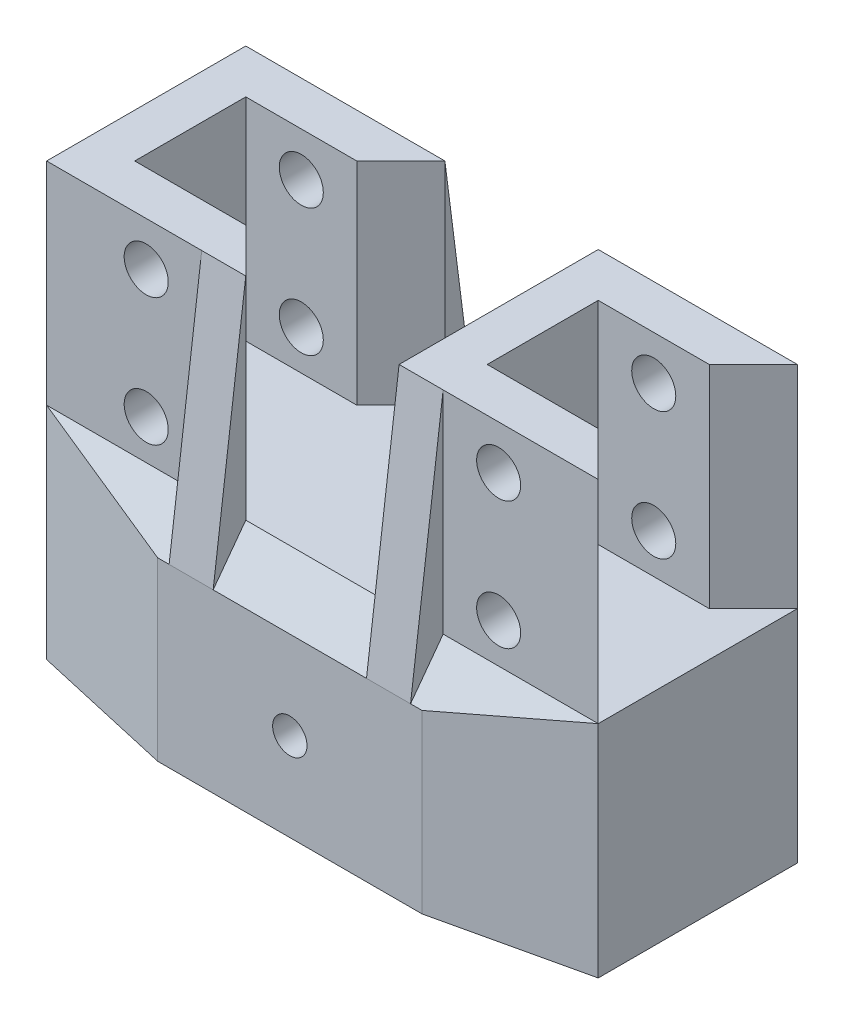
from build123d import *
from OCP.BRepFilletAPI import BRepFilletAPI_MakeChamfer

# Parameters (mm, degrees)
BOSS_EXTRUDE1_DEPTH     = 24
SKETCH2_R               = 2.5
CUT_EXTRUDE1_DEPTH      = 46.458222579
SKETCH3_W               = 62.6
SKETCH3_H               = 22.6
BOSS_EXTRUDE2_DEPTH     = 5
SKETCH4_W               = 30
SKETCH4_H               = 30
SKETCH4_W_2             = 20
SKETCH4_H_2             = 20
BOSS_EXTRUDE3_DEPTH     = 20
SKETCH6_W               = 20
SKETCH6_H               = 20
BOSS_EXTRUDE4_DEPTH     = 20
SKETCH8_W               = 2
SKETCH8_H               = 4.711017494
SKETCH8_W_2             = 4.711017494
SKETCH8_H_2             = 2
BOSS_EXTRUDE5_DEPTH     = 20
SKETCH9_W               = 5
SKETCH9_H               = 3.7
BOSS_EXTRUDE6_DEPTH     = 29
CHAMFER1_SIZE           = 29
CHAMFER1_SIZE2          = 3.7
CHAMFER3_SIZE           = 3.7
CHAMFER3_SIZE_2         = 5
CHAMFER4_SIZE           = 5
CHAMFER4_SIZE_2         = 3.7
CHAMFER5_SIZE2          = 3.7
CHAMFER5_SIZE           = 5
CUT_EXTRUDE2_DEPTH      = 45.33610267
CUT_EXTRUDE2_DEPTH_BACK = 45.33610267
SKETCH11_R              = 1.95


# Some blends are built 0.0001 mm under size
with BuildPart() as part:
    # Sketch1 → Boss-Extrude1 (new body)
    with BuildSketch(Plane(origin=(0, 0, 0), x_dir=(1, 0, 0), z_dir=(0, 1, 0))):
        Polygon((-13.7, -6.3), (-8.7, -11.3), (-31.3, -11.3), (-31.3, 11.3), (-8.7, 11.3), (-13.7, 6.3), (-26.3, 6.3), (-26.3, -6.3), align=None)
        Polygon((8.7, 11.3), (8.7, 0), (13.7, 0), (13.7, 6.3), (26.3, 6.3), (31.3, 11.3), align=None)
        Polygon((13.7, 0), (8.7, 0), (8.7, -11.3), (31.3, -11.3), (26.3, -6.3), (13.7, -6.3), align=None)
    extrude(amount=BOSS_EXTRUDE1_DEPTH)

    # Sketch2 → Cut-Extrude1 (cut, through all)
    with BuildSketch(Plane.XY.offset(11.3)):
        with Locations((-20, 19)):
            Circle(SKETCH2_R)
        with Locations((-20, 4.5)):
            Circle(SKETCH2_R)
        with Locations((20, 4.5)):
            Circle(SKETCH2_R)
        with Locations((20, 19)):
            Circle(SKETCH2_R)
    extrude(amount=-CUT_EXTRUDE1_DEPTH, mode=Mode.SUBTRACT)

    # Sketch3 → Boss-Extrude2 (add)
    with BuildSketch(Plane.XZ):
        Rectangle(SKETCH3_W, SKETCH3_H)
    extrude(amount=BOSS_EXTRUDE2_DEPTH)

    # Sketch4 → Boss-Extrude3 (add)
    with BuildSketch(Plane.XZ.offset(5)):
        Rectangle(SKETCH4_W, SKETCH4_H)
        Rectangle(SKETCH4_W_2, SKETCH4_H_2, mode=Mode.SUBTRACT)
    extrude(amount=BOSS_EXTRUDE3_DEPTH)

    # Sketch6 → Boss-Extrude4 (add)
    with BuildSketch(Plane.XZ.offset(25)):
        Polygon((15, 15), (31.3, 11.3), (31.3, -11.3), (15, -15), (-15, -15), (-31.3, -11.3), (-31.3, 11.3), (-15, 15), align=None)
        Rectangle(SKETCH6_W, SKETCH6_H, mode=Mode.SUBTRACT)
    extrude(amount=-BOSS_EXTRUDE4_DEPTH)

    # Sketch8 → Boss-Extrude5 (add)
    with BuildSketch(Plane.XZ.offset(5)):
        Polygon((4, 2.5), (4, -2.5), (8, -5), (8, -2.355508747), (8, 2.355508747), (8, 5), align=None)
        with Locations((9, 0)):
            Rectangle(SKETCH8_W, SKETCH8_H)
        with Locations((0, 9)):
            Rectangle(SKETCH8_W_2, SKETCH8_H_2)
        Polygon((5, 8), (2.355508747, 8), (-2.355508747, 8), (-5, 8), (-2.5, 4), (2.5, 4), align=None)
        with Locations((-9, 0)):
            Rectangle(SKETCH8_W, SKETCH8_H)
        Polygon((-8, 2.355508747), (-8, -2.355508747), (-8, -5), (-4, -2.5), (-4, 2.5), (-8, 5), align=None)
        with Locations((0, -9)):
            Rectangle(SKETCH8_W_2, SKETCH8_H_2)
        Polygon((-2.355508747, -8), (2.355508747, -8), (5, -8), (2.5, -4), (-2.5, -4), (-5, -8), align=None)
    extrude(amount=BOSS_EXTRUDE5_DEPTH)

    # Sketch9 → Boss-Extrude6 (add)
    with BuildSketch(Plane(origin=(0, -5, 0), x_dir=(1, 0, 0), z_dir=(0, 1, 0))):
        with Locations((11.2, 13.15)):
            Rectangle(SKETCH9_W, SKETCH9_H)
        with Locations((11.2, -13.15)):
            Rectangle(SKETCH9_W, SKETCH9_H)
        with Locations((-11.2, 13.15)):
            Rectangle(SKETCH9_W, SKETCH9_H)
        with Locations((-11.2, -13.15)):
            Rectangle(SKETCH9_W, SKETCH9_H)
    extrude(amount=BOSS_EXTRUDE6_DEPTH)

    # Chamfer1: one chamfer whose edges measure the first distance from different faces: ONE call of the kernel's chamfer builder (chamfer() names one face for all edges)
    chamfer1_edges_1 = [part.edges().sort_by_distance(p)[0] for p in [
        (11.2, 24, -15),
        (-11.2, 24, -15),
    ]]
    chamfer1_side_1 = [part.faces().sort_by_distance(p)[0] for p in [
        (0, -7.016853933, -15),
    ]]
    chamfer1_edges_2 = [part.edges().sort_by_distance(p)[0] for p in [
        (-11.2, 24, 15),
        (11.2, 24, 15),
    ]]
    chamfer1_side_2 = [part.faces().sort_by_distance(p)[0] for p in [
        (0, -7.016853933, 15),
    ]]
    chamfer1 = BRepFilletAPI_MakeChamfer(part.part.solid().wrapped)
    for e in chamfer1_edges_1:
        chamfer1.Add(CHAMFER1_SIZE, CHAMFER1_SIZE2, e.wrapped, chamfer1_side_1[0].wrapped)  # the first distance lies on this face
    for e in chamfer1_edges_2:
        chamfer1.Add(CHAMFER1_SIZE, CHAMFER1_SIZE2, e.wrapped, chamfer1_side_2[0].wrapped)  # the first distance lies on this face
    add(Compound.cast(chamfer1.Shape()), mode=Mode.REPLACE)

    # Chamfer3
    # the kernel refuses this chamfer: 5, 3.7 mm, written as the material it adds along each edge
    with BuildSketch(Plane(origin=(21.605348649, -5, -11.3), x_dir=(0, -0.04206007695140814, -0.9991150834247482), z_dir=(-1, 0, 0))) as chamfer3_piece_1_section:
        Polygon((CHAMFER3_SIZE * 0.999115083425, -CHAMFER3_SIZE * 0.0420600769514), (-CHAMFER3_SIZE_2 * 0.0420600769514, -CHAMFER3_SIZE_2 * 0.999115083425), (0, 0), align=None)
    chamfer3_piece_1 = extrude(amount=43.210697297, mode=Mode.PRIVATE)
    chamfer3_piece_1 = split(chamfer3_piece_1, bisect_by=Plane(origin=(13.7, -3.301546392, -12.48628866), z_dir=(-1, 0, 0)), keep=Keep.TOP, mode=Mode.PRIVATE)
    chamfer3_piece_1 = split(chamfer3_piece_1, bisect_by=Plane(origin=(-13.7, -3.301546392, -12.48628866), z_dir=(1, 0, 0)), keep=Keep.TOP, mode=Mode.PRIVATE)
    add(chamfer3_piece_1)

    # Chamfer4
    chamfer4_edges_1 = [part.edges().sort_by_distance(p)[0] for p in [
        (22.5, -5, 11.3),
    ]]
    chamfer4_side_1 = [part.faces().sort_by_distance(p)[0] for p in [
        (22.5, -4.926, 11.3),
    ]]
    chamfer4_edges_2 = [part.edges().sort_by_distance(p)[0] for p in [
        (-22.5, -5, 11.3),
    ]]
    chamfer4_side_2 = [part.faces().sort_by_distance(p)[0] for p in [
        (-22.5, -4.926, 11.3),
    ]]
    chamfer4_edges_3 = [part.edges().sort_by_distance(p)[0] for p in [
        (22.5, -5, -11.3),
    ]]
    chamfer4_side_3 = [part.faces().sort_by_distance(p)[0] for p in [
        (22.5, -5, -11.374),
    ]]
    chamfer4_edges_4 = [part.edges().sort_by_distance(p)[0] for p in [
        (-22.5, -5, -11.3),
    ]]
    chamfer4_side_4 = [part.faces().sort_by_distance(p)[0] for p in [
        (-22.5, -5, -11.374),
    ]]
    chamfer4 = BRepFilletAPI_MakeChamfer(part.part.solid().wrapped)
    for e in chamfer4_edges_1:
        chamfer4.Add(CHAMFER4_SIZE - 0.0001, CHAMFER4_SIZE_2 - 0.0001, e.wrapped, chamfer4_side_1[0].wrapped)
    for e in chamfer4_edges_2:
        chamfer4.Add(CHAMFER4_SIZE - 0.0001, CHAMFER4_SIZE_2 - 0.0001, e.wrapped, chamfer4_side_2[0].wrapped)
    for e in chamfer4_edges_3:
        chamfer4.Add(CHAMFER4_SIZE_2 - 0.0001, CHAMFER4_SIZE - 0.0001, e.wrapped, chamfer4_side_3[0].wrapped)
    for e in chamfer4_edges_4:
        chamfer4.Add(CHAMFER4_SIZE_2 - 0.0001, CHAMFER4_SIZE - 0.0001, e.wrapped, chamfer4_side_4[0].wrapped)
    add(Compound.cast(chamfer4.Shape()), mode=Mode.REPLACE)  # a hair under: the kernel refuses the full size

    # Chamfer5
    chamfer5_edges = [part.edges().sort_by_distance(p)[0] for p in [
        (0, -5, 11.3),
    ]]
    chamfer5_side = [part.faces().sort_by_distance(p)[0] for p in [
        (0, -4.926, 11.3),
    ]]
    chamfer(chamfer5_edges, length=CHAMFER5_SIZE - 0.0001, length2=CHAMFER5_SIZE2 - 0.0001, reference=chamfer5_side[0])  # a hair under: the kernel refuses the full size

    # Sketch11 → Cut-Extrude2 (cut, two sides: drawn at the far end of the back side and taken through both)
    with BuildSketch(Plane.XY.offset(-4).offset(-CUT_EXTRUDE2_DEPTH_BACK)):
        with Locations((0, -15)):
            Circle(SKETCH11_R)
    extrude(amount=CUT_EXTRUDE2_DEPTH + CUT_EXTRUDE2_DEPTH_BACK, mode=Mode.SUBTRACT)


solid = part.part
